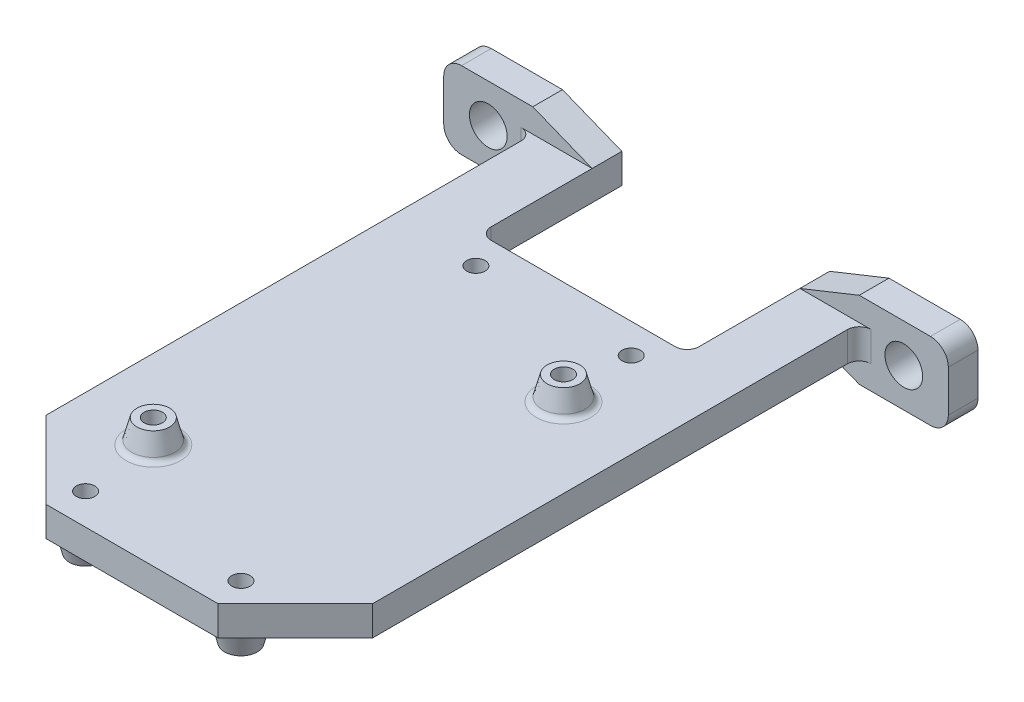
from build123d import *

# Parameters (mm, degrees)
BOSS_EXTRUDE1_DEPTH = 2.5
SKETCH2_R           = 3.175
BOSS_EXTRUDE2_DEPTH = 5
FILLET1_R           = 3
SKETCH3_R           = 1.55
CUT_EXTRUDE1_DEPTH  = 110.028665955
FILLET2_R           = 2
BOSS_EXTRUDE3_START = 4
SKETCH4_R           = 2.75
SKETCH4_R_2         = 1.55
BOSS_EXTRUDE3_DEPTH = 4
SKETCH5_R           = 2.75
SKETCH5_R_2         = 1.55
BOSS_EXTRUDE4_DEPTH = 4
FILLET4_R           = 1
CHAMFER1_SIZE       = 13


# Read off the part's stored shape, not the designer's step: Draft1, Draft2
with BuildPart() as part:
    # Sketch1 → Boss-Extrude1 (new, symmetric)
    with BuildSketch(Plane(origin=(0, 0, 0), x_dir=(1, 0, 0), z_dir=(0, 1, 0))):
        Polygon((-27.5, 0), (-27.5, 100), (-17.5, 100), (-17.5, 76), (17.5, 76), (17.5, 100), (27.5, 100), (27.5, 0), align=None)
    extrude(amount=BOSS_EXTRUDE1_DEPTH, both=True)

    # Sketch2 → Boss-Extrude2 (add)
    # profile 1 of 2: a face of its own
    with BuildSketch(Plane(origin=(0, 0, -100), x_dir=(-1, 0, 0), z_dir=(0, 0, -1))):
        Polygon((-27.5, -6.5), (-42.5, -6.5), (-42.5, 6.5), (-27.5, 6.5), (-17.5, 2.5), (-17.5, -2.5), align=None)
        with Locations((-35, 0)):
            Circle(SKETCH2_R, mode=Mode.SUBTRACT)
    # profile 2 of 2: a face of its own
    with BuildSketch(Plane(origin=(0, 0, -100), x_dir=(-1, 0, 0), z_dir=(0, 0, -1))):
        Polygon((42.5, -6.5), (27.5, -6.5), (17.5, -2.5), (17.5, 2.5), (27.5, 6.5), (42.5, 6.5), align=None)
        with Locations((35, 0)):
            Circle(SKETCH2_R, mode=Mode.SUBTRACT)
    extrude(amount=-BOSS_EXTRUDE2_DEPTH)

    # Fillet1
    fillet1_edges = [part.edges().sort_by_distance(p)[0] for p in [
        (42.5, -6.5, -97.5),
        (42.5, 6.5, -97.5),
        (-42.5, 6.5, -97.5),
        (-42.5, -6.5, -97.5),
    ]]
    fillet(fillet1_edges, radius=FILLET1_R)

    # Sketch3 → Cut-Extrude1 (cut, through all)
    with BuildSketch(Plane.XZ.offset(2.5)):
        with Locations(Location((-13.085, -5.25, 0), (0, 0, 270))):
            Circle(SKETCH3_R)
        with Locations(Location((13.085, -5.25, 0), (0, 0, 270))):
            Circle(SKETCH3_R)
        with Locations(Location((13.085, -71, 0), (0, 0, 270))):
            Circle(SKETCH3_R)
        with Locations(Location((-13.085, -71, 0), (0, 0, 270))):
            Circle(SKETCH3_R)
        with Locations(Location((-14.125, -17.7, 0), (0, 0, 270))):
            Circle(SKETCH3_R)
        with Locations(Location((14.125, -58.55, 0), (0, 0, 270))):
            Circle(SKETCH3_R)
    extrude(amount=-CUT_EXTRUDE1_DEPTH, mode=Mode.SUBTRACT)

    # Fillet2
    fillet2_edges = [part.edges().sort_by_distance(p)[0] for p in [
        (-17.5, 0, -76),
        (17.5, 0, -76),
        (27.5, 0, -95),
        (-27.5, 0, -95),
    ]]
    fillet(fillet2_edges, radius=FILLET2_R)

    # Sketch4 → Boss-Extrude3 (add)
    # profile 1 of 4: a face of its own
    with BuildSketch(Plane.XZ.offset(2.5).offset(BOSS_EXTRUDE3_START)):
        with Locations(Location((-13.085, -5.25, 0), (0, 0, 270))):
            Circle(SKETCH4_R)
        with Locations(Location((-13.085, -5.25, 0), (0, 0, 270))):
            Circle(SKETCH4_R_2, mode=Mode.SUBTRACT)
    # profile 2 of 4: a face of its own
    with BuildSketch(Plane.XZ.offset(2.5).offset(BOSS_EXTRUDE3_START)):
        with Locations(Location((13.085, -5.25, 0), (0, 0, 270))):
            Circle(SKETCH4_R)
        with Locations(Location((13.085, -5.25, 0), (0, 0, 270))):
            Circle(SKETCH4_R_2, mode=Mode.SUBTRACT)
    # profile 3 of 4: a face of its own
    with BuildSketch(Plane.XZ.offset(2.5).offset(BOSS_EXTRUDE3_START)):
        with Locations(Location((-13.085, -71, 0), (0, 0, 270))):
            Circle(SKETCH4_R)
        with Locations(Location((-13.085, -71, 0), (0, 0, 270))):
            Circle(SKETCH4_R_2, mode=Mode.SUBTRACT)
    # profile 4 of 4: a face of its own
    with BuildSketch(Plane.XZ.offset(2.5).offset(BOSS_EXTRUDE3_START)):
        with Locations(Location((13.085, -71, 0), (0, 0, 270))):
            Circle(SKETCH4_R)
        with Locations(Location((13.085, -71, 0), (0, 0, 270))):
            Circle(SKETCH4_R_2, mode=Mode.SUBTRACT)
    extrude(amount=-BOSS_EXTRUDE3_DEPTH)

    # Sketch5 → Boss-Extrude4 (add)
    # profile 1 of 2: a face of its own
    with BuildSketch(Plane(origin=(0, 2.5, 0), x_dir=(1, 0, 0), z_dir=(0, 1, 0))):
        with Locations(Location((-14.125, 17.7, 0), (0, 0, 90))):
            Circle(SKETCH5_R)
        with Locations(Location((-14.125, 17.7, 0), (0, 0, 90))):
            Circle(SKETCH5_R_2, mode=Mode.SUBTRACT)
    # profile 2 of 2: a face of its own
    with BuildSketch(Plane(origin=(0, 2.5, 0), x_dir=(1, 0, 0), z_dir=(0, 1, 0))):
        with Locations(Location((14.125, 58.55, 0), (0, 0, 90))):
            Circle(SKETCH5_R)
        with Locations(Location((14.125, 58.55, 0), (0, 0, 90))):
            Circle(SKETCH5_R_2, mode=Mode.SUBTRACT)
    extrude(amount=BOSS_EXTRUDE4_DEPTH)

    # Draft1 outline → Draft1 (revolve)
    with BuildSketch(Plane(origin=(-13.085, 0, -5.25), x_dir=(1, 0, 0), z_dir=(0, 0, 1))):
        Polygon((2.75, -2.5), (2.75, -6.5), (3.82179677, -2.5), align=None)
    revolve(axis=Axis((-13.085, 0, -5.25), (0, 1, 0)))

    # Draft1 2 outline → Draft1 2 (revolve)
    with BuildSketch(Plane(origin=(13.085, 0, -5.25), x_dir=(1, 0, 0), z_dir=(0, 0, 1))):
        Polygon((2.75, -2.5), (2.75, -6.5), (3.82179677, -2.5), align=None)
    revolve(axis=Axis((13.085, 0, -5.25), (0, 1, 0)))

    # Draft1 3 outline → Draft1 3 (revolve)
    with BuildSketch(Plane(origin=(-13.085, 0, -71), x_dir=(1, 0, 0), z_dir=(0, 0, 1))):
        Polygon((2.75, -2.5), (2.75, -6.5), (3.82179677, -2.5), align=None)
    revolve(axis=Axis((-13.085, 0, -71), (0, 1, 0)))

    # Draft1 4 outline → Draft1 4 (revolve)
    with BuildSketch(Plane(origin=(13.085, 0, -71), x_dir=(1, 0, 0), z_dir=(0, 0, 1))):
        Polygon((2.75, -2.5), (2.75, -6.5), (3.82179677, -2.5), align=None)
    revolve(axis=Axis((13.085, 0, -71), (0, 1, 0)))

    # Draft2 outline → Draft2 (revolve)
    with BuildSketch(Plane(origin=(-14.125, 0, -17.7), x_dir=(1, 0, 0), z_dir=(0, 0, 1))):
        Polygon((3.82179677, 2.5), (2.75, 6.5), (2.75, 2.5), align=None)
    revolve(axis=Axis((-14.125, 0, -17.7), (0, 1, 0)))

    # Draft2 2 outline → Draft2 2 (revolve)
    with BuildSketch(Plane(origin=(14.125, 0, -58.55), x_dir=(1, 0, 0), z_dir=(0, 0, 1))):
        Polygon((3.82179677, 2.5), (2.75, 6.5), (2.75, 2.5), align=None)
    revolve(axis=Axis((14.125, 0, -58.55), (0, 1, 0)))

    # Fillet4
    fillet4_edges = [part.edges().sort_by_distance(p)[0] for p in [
        (-16.90679677, -2.5, -5.25),
        (9.26320323, -2.5, -5.25),
        (-16.90679677, -2.5, -71),
        (9.26320323, -2.5, -71),
        (-17.94679677, 2.5, -17.7),
        (10.30320323, 2.5, -58.55),
    ]]
    fillet(fillet4_edges, radius=FILLET4_R)

    # Chamfer1
    chamfer1_edges = [part.edges().sort_by_distance(p)[0] for p in [
        (-27.5, 0, 0),
        (27.5, 0, 0),
    ]]
    chamfer(chamfer1_edges, length=CHAMFER1_SIZE)


solid = part.part
